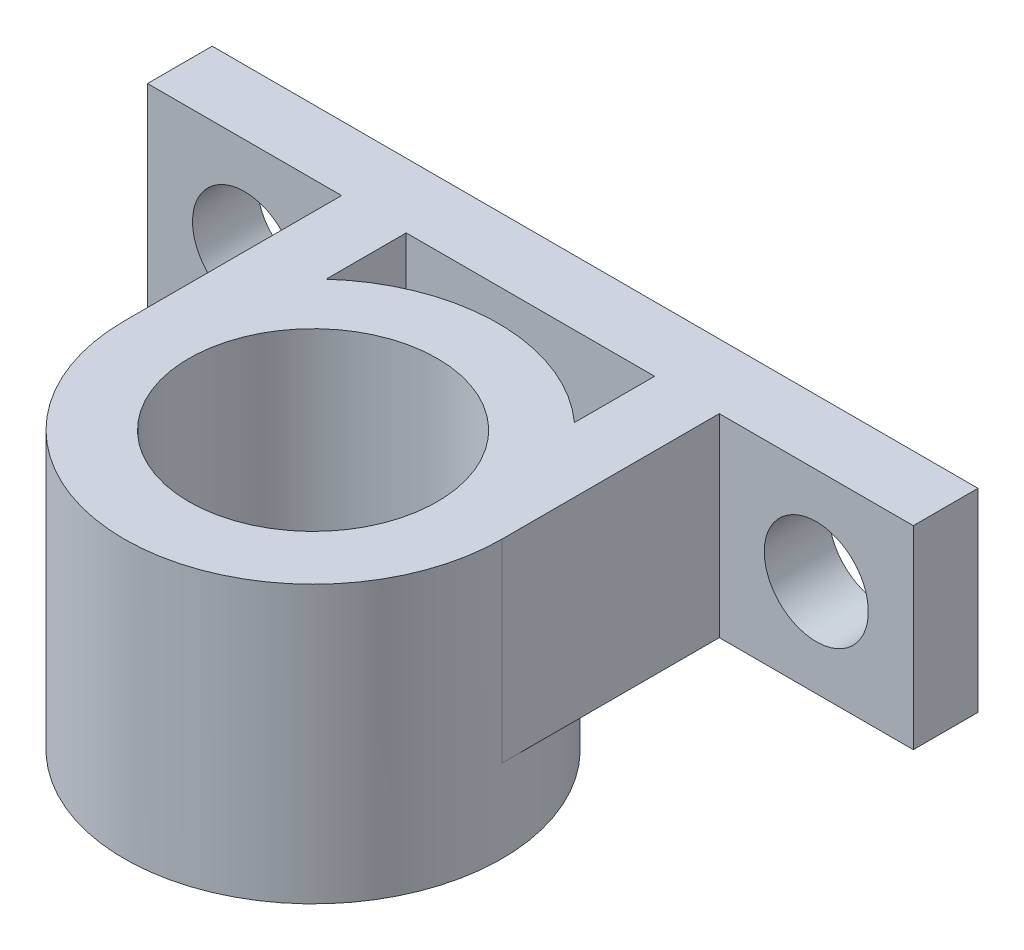
from build123d import *
from build123d.topology import SkipClean

# Parameters (mm, degrees)
SKETCH1_R           = 6.096
BOSS_EXTRUDE1_DEPTH = 9.525
SKETCH2_R           = 2.5527
CUT_EXTRUDE1_DEPTH  = 30.009980386
BOSS_EXTRUDE2_START = 2.794
SKETCH3_R           = 9.271
SKETCH3_R_2         = 6.096
BOSS_EXTRUDE2_DEPTH = 2.794
BOSS_EXTRUDE3_START = 1.27
SKETCH4_R           = 9.271
SKETCH4_R_2         = 4.826
BOSS_EXTRUDE3_DEPTH = 1.27


with BuildPart() as part:
    # Sketch1 → Boss-Extrude1 (new body)
    with BuildSketch(Plane(origin=(0, 0, 0), x_dir=(1, 0, 0), z_dir=(0, 1, 0))):
        with BuildLine():
            Line((-9.271, 0), (-9.271, 10.668))
            Line((-9.271, 10.668), (-18.796, 10.668))
            Line((-18.796, 10.668), (-18.796, 13.843))
            Line((-18.796, 13.843), (-6.096, 13.843))
            Line((-6.096, 13.843), (6.096, 13.843))
            Line((6.096, 13.843), (18.796, 13.843))
            Line((18.796, 13.843), (18.796, 10.668))
            Line((18.796, 10.668), (9.271, 10.668))
            Line((9.271, 10.668), (9.271, 0))
            ThreePointArc((9.271, 0), (0, -9.271), (-9.271, 0))
        make_face()
        Circle(SKETCH1_R, mode=Mode.SUBTRACT)
        with BuildLine():
            Line((-6.096, 6.731), (-6.096, 10.668))
            Line((-6.096, 10.668), (6.096, 10.668))
            Line((6.096, 10.668), (6.096, 6.731))
            ThreePointArc((6.096, 6.731), (0, 9.081166059), (-6.096, 6.731))
        make_face(mode=Mode.SUBTRACT)
    extrude(amount=BOSS_EXTRUDE1_DEPTH)

    # Sketch2 → Cut-Extrude1 (cut, through all)
    with BuildSketch(Plane.XY.offset(-10.668)):
        with Locations((-14.0335, 4.7625)):
            Circle(SKETCH2_R)
        with Locations((14.0335, 4.7625)):
            Circle(SKETCH2_R)
    extrude(amount=-CUT_EXTRUDE1_DEPTH, mode=Mode.SUBTRACT)

    # Sketch3 → Boss-Extrude2 (add)
    with SkipClean():  # the faces are left unmerged after this step: merging them gives an invalid solid
        with BuildSketch(Plane(origin=(0, 0, 0), x_dir=(-1, 0, 0), z_dir=(0, -1, 0)).offset(BOSS_EXTRUDE2_START)):
            Circle(SKETCH3_R)
            Circle(SKETCH3_R_2, mode=Mode.SUBTRACT)
        extrude(amount=-BOSS_EXTRUDE2_DEPTH)

    # Sketch4 → Boss-Extrude3 (add)
    with SkipClean():  # the faces are left unmerged after this step: merging them gives an invalid solid
        with BuildSketch(Plane(origin=(0, -2.794, 0), x_dir=(-1, 0, 0), z_dir=(0, -1, 0)).offset(BOSS_EXTRUDE3_START)):
            Circle(SKETCH4_R)
            Circle(SKETCH4_R_2, mode=Mode.SUBTRACT)
        extrude(amount=-BOSS_EXTRUDE3_DEPTH)


solid = part.part
